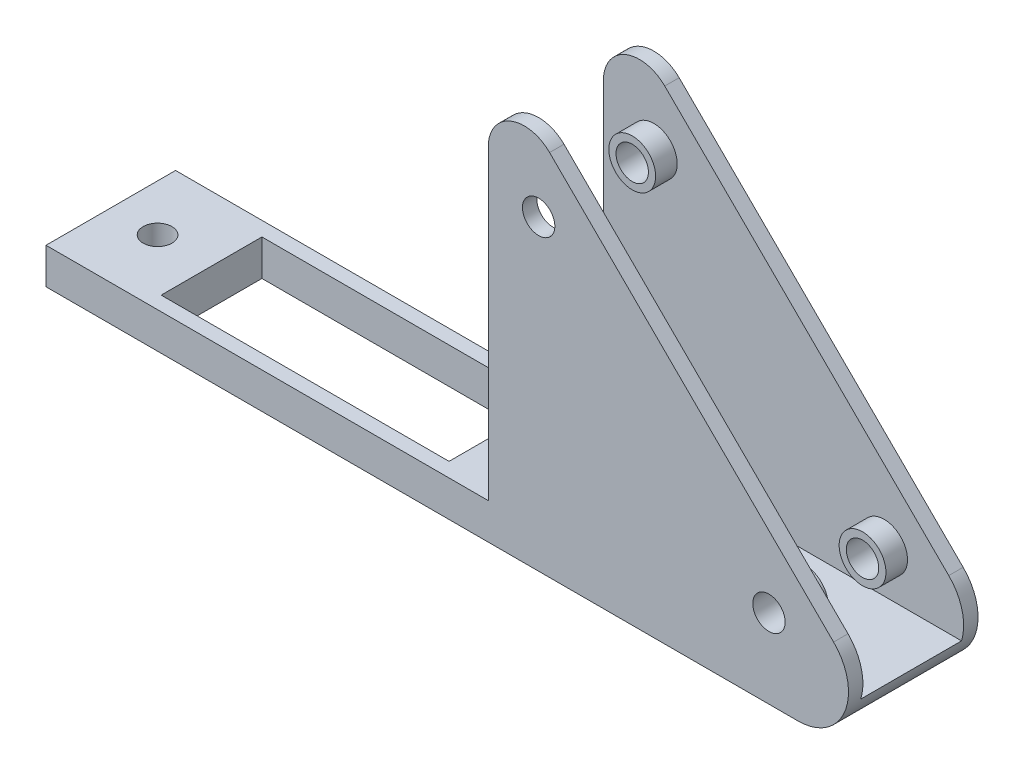
from build123d import *

# Parameters (mm, degrees)
SKETCH1_W           = 116.445688755
SKETCH1_H           = 18
SKETCH1_R           = 2
SKETCH1_W_2         = 40
SKETCH1_H_2         = 14
BOSS_EXTRUDE1_DEPTH = 5
SKETCH2_R           = 2.25
BOSS_EXTRUDE2_DEPTH = 2
BOSS_EXTRUDE3_START = -2
SKETCH4_R           = 2.25
BOSS_EXTRUDE3_DEPTH = 2
FILLET2_R           = 7
FILLET3_R           = 5
SKETCH6_R           = 3.25
SKETCH6_R_2         = 2.25
BOSS_EXTRUDE4_DEPTH = 3
BOSS_EXTRUDE5_START = 3
SKETCH7_R           = 3.25
SKETCH7_R_2         = 2.25
BOSS_EXTRUDE5_DEPTH = 3


with BuildPart() as part:
    # Sketch1 → Boss-Extrude1 (new body)
    with BuildSketch(Plane(origin=(0, 0, 0), x_dir=(1, 0, 0), z_dir=(0, 1, 0))):
        with Locations((22.222844378, 0)):
            Rectangle(SKETCH1_W, SKETCH1_H)
        with Locations(Location((-29.5, 0, 0), (0, 0, 270))):
            Circle(SKETCH1_R, mode=Mode.SUBTRACT)
        with Locations(Location((25.5, 0, 0), (0, 0, 270))):
            Circle(SKETCH1_R, mode=Mode.SUBTRACT)
        with Locations((-2, 0)):
            Rectangle(SKETCH1_W_2, SKETCH1_H_2, mode=Mode.SUBTRACT)
    extrude(amount=BOSS_EXTRUDE1_DEPTH)

    # Sketch2 → Boss-Extrude2 (add)
    # profile 1 of 2: a face of its own
    with BuildSketch(Plane.XY.offset(9)):
        Polygon((85.482180719, 0), (80.445688755, 5), (80.445688755, 0), align=None)
    # profile 2 of 2: a face of its own
    with BuildSketch(Plane.XY.offset(9)):
        Polygon((25.445687742, 59.601497833), (25.445688755, 5), (80.445688755, 5), align=None)
        with Locations((64.445688755, 11)):
            Circle(SKETCH2_R, mode=Mode.SUBTRACT)
        with Locations((32.447088786, 42.64)):
            Circle(SKETCH2_R, mode=Mode.SUBTRACT)
    extrude(amount=-BOSS_EXTRUDE2_DEPTH)

    # Sketch4 → Boss-Extrude3 (add)
    # profile 1 of 2: a face of its own
    with BuildSketch(Plane(origin=(0, 0, -9), x_dir=(-1, 0, 0), z_dir=(0, 0, -1)).offset(BOSS_EXTRUDE3_START)):
        Polygon((-25.445687742, 59.601497833), (-80.445688755, 5), (-25.445687742, 5), align=None)
        with Locations(Location((-64.445688755, 11, 0), (0, 0, 180))):
            Circle(SKETCH4_R, mode=Mode.SUBTRACT)
        with Locations(Location((-32.447088786, 42.64, 0), (0, 0, 180))):
            Circle(SKETCH4_R, mode=Mode.SUBTRACT)
    # profile 2 of 2: a face of its own
    with BuildSketch(Plane(origin=(0, 0, -9), x_dir=(-1, 0, 0), z_dir=(0, 0, -1)).offset(BOSS_EXTRUDE3_START)):
        Polygon((-80.445688755, 5), (-85.482180719, 0), (-80.445688755, 0), align=None)
    extrude(amount=BOSS_EXTRUDE3_DEPTH)

    # Fillet2
    # the kernel refuses this fillet: 7 mm, written as the material it takes off along each edge
    with BuildSketch(Plane(origin=(85.482180719, 0, 35.466936405), x_dir=(-1, 0, 0), z_dir=(0, 0, -1))) as fillet2_piece_1:
        with BuildLine():
            CenterArc((FILLET2_R * 2.42668208026, FILLET2_R), FILLET2_R, 134.791677578, 135.208322422)
            Line((FILLET2_R * 1.72215094548, FILLET2_R * 1.70967307975), (0, 0))
            Line((0, 0), (FILLET2_R * 2.42668208026, 0))
        make_face()
    extrude(amount=86.933872809, mode=Mode.SUBTRACT)

    # Fillet3
    fillet3_edges = [part.edges().sort_by_distance(p)[0] for p in [
        (25.445687742, 59.601497833, 8),
        (25.445687742, 59.601497833, -8),
    ]]
    fillet(fillet3_edges, radius=FILLET3_R)

    # Sketch6 → Boss-Extrude4 (add)
    with BuildSketch(Plane(origin=(0, 0, 7), x_dir=(-1, 0, 0), z_dir=(0, 0, -1))):
        with Locations(Location((-64.445688755, 11, 0), (0, 0, 180))):
            Circle(SKETCH6_R)
        with Locations(Location((-64.445688755, 11, 0), (0, 0, 180))):
            Circle(SKETCH6_R_2, mode=Mode.SUBTRACT)
    extrude(amount=BOSS_EXTRUDE4_DEPTH)

    # Sketch7 → Boss-Extrude5 (add)
    # profile 1 of 2: a face of its own
    with BuildSketch(Plane.XY.offset(-7).offset(BOSS_EXTRUDE5_START)):
        with Locations(Location((32.447088786, 42.64, 0), (0, 0, 180))):
            Circle(SKETCH7_R)
        with Locations((32.447088786, 42.64)):
            Circle(SKETCH7_R_2, mode=Mode.SUBTRACT)
    # profile 2 of 2: a face of its own
    with BuildSketch(Plane.XY.offset(-7).offset(BOSS_EXTRUDE5_START)):
        with Locations((64.445688755, 11)):
            Circle(SKETCH7_R)
        with Locations((64.445688755, 11)):
            Circle(SKETCH7_R_2, mode=Mode.SUBTRACT)
    extrude(amount=-BOSS_EXTRUDE5_DEPTH)


solid = part.part
